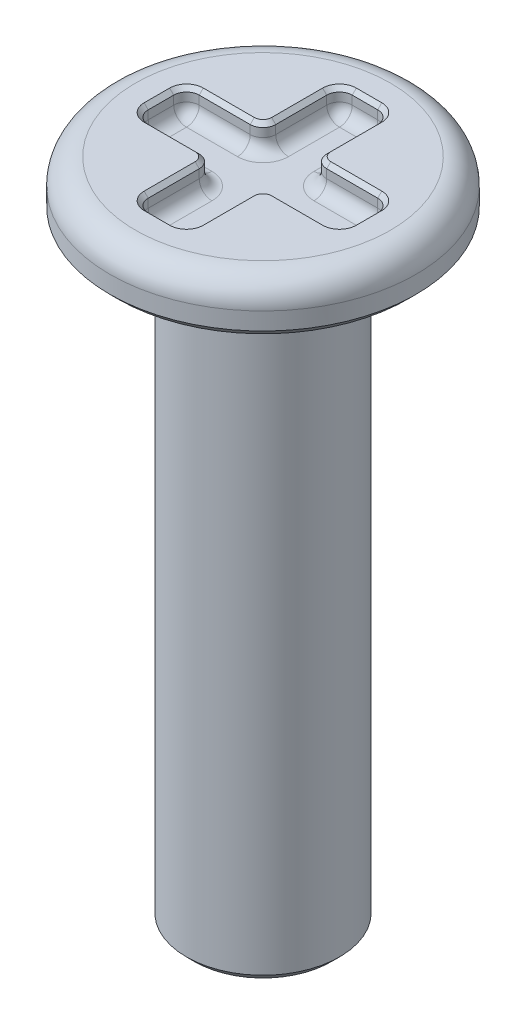
from build123d import *

# Parameters (mm, degrees)
CUT_EXTRUDE1_DEPTH = 0.79375
FILLET2_R          = 0.79375
FILLET3_R          = 0.396875
CHAMFER1_SIZE      = 0.254
CHAMFER2_SIZE      = 0.127


with BuildPart() as part:
    # Sketch1 → Revolve1 (revolve)
    with BuildSketch(Plane.XY):
        Polygon((0, 0), (2.38125, 0), (2.38125, 19.05), (4.7625, 19.05), (4.7625, 20.6375), (0, 20.6375), align=None)
    revolve(axis=Axis((0, 5.173549107, 0), (0, -1, 0)))

    # Sketch2 → Cut-Extrude1 (cut)
    with BuildSketch(Plane(origin=(0, 20.6375, 0), x_dir=(1, 0, 0), z_dir=(0, 1, 0))):
        Polygon((-3.175, 0.79375), (-0.79375, 0.79375), (-0.79375, 3.175), (0.79375, 3.175), (0.79375, 0.79375), (3.175, 0.79375), (3.175, -0.79375), (0.79375, -0.79375), (0.79375, -3.175), (-0.79375, -3.175), (-0.79375, -0.79375), (-3.175, -0.79375), align=None)
    extrude(amount=-CUT_EXTRUDE1_DEPTH, mode=Mode.SUBTRACT)

    # Fillet2
    fillet2_edges = [part.edges().sort_by_distance(p)[0] for p in [
        (-4.7625, 20.6375, 0),
        (-2.38125, 19.05, 0),
    ]]
    fillet(fillet2_edges, radius=FILLET2_R)

    # Fillet3
    fillet3_edges = [part.edges().sort_by_distance(p)[0] for p in [
        (-1.984375, 19.84375, -0.79375),
        (-0.79375, 19.84375, -1.984375),
        (0, 19.84375, -3.175),
        (0.79375, 19.84375, -1.984375),
        (1.984375, 19.84375, -0.79375),
        (3.175, 19.84375, 0),
        (1.984375, 19.84375, 0.79375),
        (0.79375, 19.84375, 1.984375),
        (0, 19.84375, 3.175),
        (-0.79375, 19.84375, 1.984375),
        (-1.984375, 19.84375, 0.79375),
        (-3.175, 19.84375, 0),
        (-3.175, 20.240625, -0.79375),
        (-3.175, 20.240625, 0.79375),
        (-0.79375, 20.240625, 0.79375),
        (-0.79375, 20.240625, 3.175),
        (0.79375, 20.240625, 3.175),
        (0.79375, 20.240625, 0.79375),
        (3.175, 20.240625, 0.79375),
        (3.175, 20.240625, -0.79375),
        (0.79375, 20.240625, -0.79375),
        (-0.79375, 20.240625, -3.175),
        (-0.79375, 20.240625, -0.79375),
        (0.79375, 20.240625, -3.175),
    ]]
    fillet(fillet3_edges, radius=FILLET3_R)

    # Chamfer1
    chamfer1_edges = [part.edges().sort_by_distance(p)[0] for p in [
        (-2.38125, 0, 0),
        (-4.7625, 19.05, 0),
    ]]
    chamfer(chamfer1_edges, length=CHAMFER1_SIZE)

    # Chamfer2
    chamfer2_edges = [part.edges().sort_by_distance(p)[0] for p in [
        (0.677508004, 20.6375, 3.058758004),
        (0.79375, 20.6375, 1.984375),
        (-0.677508004, 20.6375, 3.058758004),
        (0.909991996, 20.6375, 0.909991996),
        (-0.79375, 20.6375, 1.984375),
        (1.984375, 20.6375, 0.79375),
        (-0.909991996, 20.6375, 0.909991996),
        (3.058758004, 20.6375, 0.677508004),
        (-1.984375, 20.6375, 0.79375),
        (-3.058758004, 20.6375, 0.677508004),
        (3.058758004, 20.6375, -0.677508004),
        (1.984375, 20.6375, -0.79375),
        (-3.058758004, 20.6375, -0.677508004),
        (0.909991996, 20.6375, -0.909991996),
        (-1.984375, 20.6375, -0.79375),
        (0.79375, 20.6375, -1.984375),
        (-0.909991996, 20.6375, -0.909991996),
        (0.677508004, 20.6375, -3.058758004),
        (-0.79375, 20.6375, -1.984375),
        (-0.677508004, 20.6375, -3.058758004),
        (0, 20.6375, 3.175),
        (-3.175, 20.6375, 0),
        (3.175, 20.6375, 0),
        (0, 20.6375, -3.175),
    ]]
    chamfer(chamfer2_edges, length=CHAMFER2_SIZE)


solid = part.part
